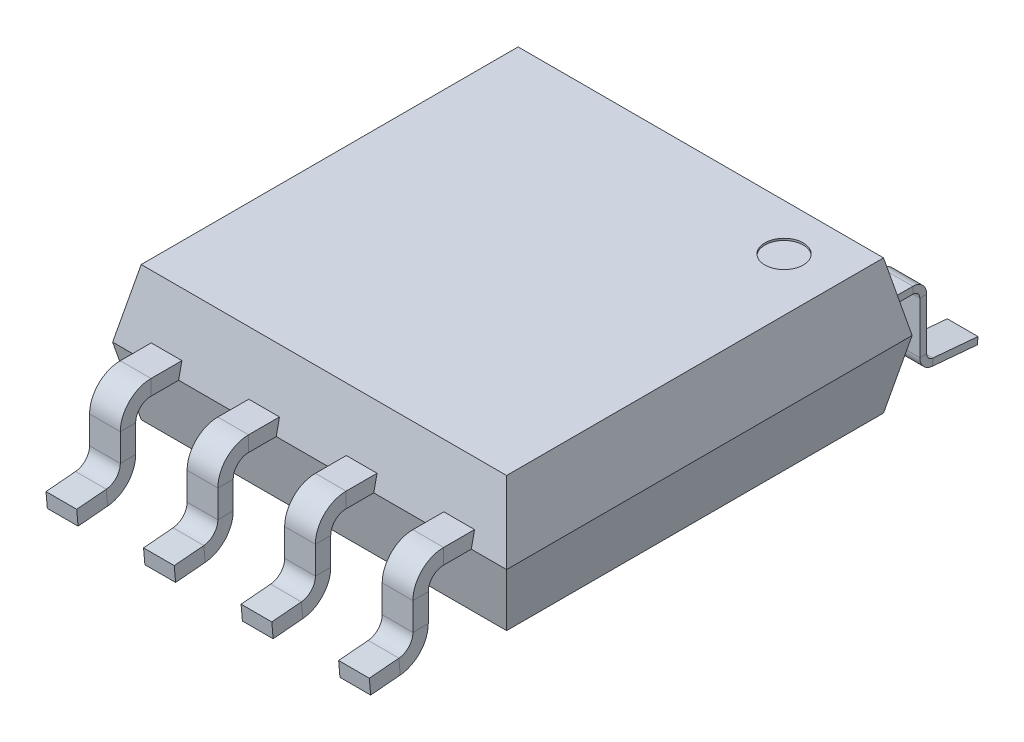
from build123d import *

# Parameters (mm, degrees)
SKETCH1_W                     = 5.13
SKETCH1_H                     = 5.28
BOSS_EXTRUDE1_DEPTH           = 0.875
BOSS_EXTRUDE1_TAPER           = 12
BOSS_EXTRUDE1_OTHER_WAY_DEPTH = 0.875
BOSS_EXTRUDE1_OTHER_WAY_TAPER = 12
BASE_FLANGE1_DEPTH            = 0.2
BASE_FLANGE1_DEPTH_BACK       = 0.2
LPATTERN1_COUNT               = 3
LPATTERN1_PITCH               = 1.27
LPATTERN1_2_COUNT             = 2
LPATTERN1_2_PITCH             = 1.27
BASE_FLANGE2_DEPTH            = 0.2
BASE_FLANGE2_DEPTH_BACK       = 0.2
LPATTERN2_COUNT               = 2
LPATTERN2_PITCH               = 1.27
LPATTERN2_2_COUNT             = 3
LPATTERN2_2_PITCH             = 1.27
SKETCH87_R                    = 0.25
CUT_EXTRUDE1_DEPTH            = 0.025


# Sheet-metal steps are written as plain solids
with BuildPart() as part:
    # Sketch1 → Boss-Extrude1 (new body)
    with BuildSketch(Plane(origin=(0, 0, 0), x_dir=(1, 0, 0), z_dir=(0, 1, 0))):
        Rectangle(SKETCH1_W, SKETCH1_H)
    extrude(amount=BOSS_EXTRUDE1_DEPTH, taper=BOSS_EXTRUDE1_TAPER)

    # Sketch1 → Boss-Extrude1 other way (add)
    with BuildSketch(Plane(origin=(0, 0, 0), x_dir=(1, 0, 0), z_dir=(0, 1, 0))):
        Rectangle(SKETCH1_W, SKETCH1_H)
    extrude(amount=-BOSS_EXTRUDE1_OTHER_WAY_DEPTH, taper=BOSS_EXTRUDE1_OTHER_WAY_TAPER)

    # Sketch87 → Cut-Extrude1 (cut)
    with BuildSketch(Plane(origin=(0, 0.875, 0), x_dir=(1, 0, 0), z_dir=(0, 1, 0))):
        with Locations(Location((1.686972144, 1.850895493, 0), (0, 0, 270))):
            Circle(SKETCH87_R)
    extrude(amount=-CUT_EXTRUDE1_DEPTH, mode=Mode.SUBTRACT)


with BuildPart() as body_2:
    # Sketch2 → Base-Flange1 (new, two sides: drawn at the far end of the back side and taken through both)
    with BuildSketch(Plane(origin=(-0.635, 0, 0), x_dir=(0, 0, -1), z_dir=(1, 0, 0)).offset(-BASE_FLANGE1_DEPTH_BACK)):
        with BuildLine():
            Line((-2.54, 0), (-2.64, 0))
            Line((-2.64, 0), (-3, 0))
            ThreePointArc((-3, 0), (-3.141421356, -0.058578644), (-3.2, -0.2))
            Line((-3.2, -0.2), (-3.2, -0.55846753))
            ThreePointArc((-3.2, -0.55846753), (-3.305089065, -0.828703613), (-3.565137703, -0.95694541))
            Line((-3.565137703, -0.95694541), (-3.95, -0.990616498))
            Line((-3.95, -0.990616498), (-3.967431149, -0.791377558))
            Line((-3.967431149, -0.791377558), (-3.582568851, -0.75770647))
            ThreePointArc((-3.582568851, -0.75770647), (-3.452544533, -0.693585572), (-3.4, -0.55846753))
            Line((-3.4, -0.55846753), (-3.4, -0.2))
            ThreePointArc((-3.4, -0.2), (-3.282842712, 0.082842712), (-3, 0.2))
            Line((-3, 0.2), (-2.64, 0.2))
            Line((-2.64, 0.2), (-2.54, 0.2))
            Line((-2.54, 0.2), (-2.54, 0))
        make_face()
    extrude(amount=BASE_FLANGE1_DEPTH + BASE_FLANGE1_DEPTH_BACK)


with BuildPart() as lpattern1_1:
    # LPattern1: pattern copy
    add(body_2.part.moved(Location(Vector(1, 0, 0) * (1 * LPATTERN1_PITCH))))


with BuildPart() as lpattern1_2:
    # LPattern1: pattern copy
    add(body_2.part.moved(Location(Vector(1, 0, 0) * (2 * LPATTERN1_PITCH))))


with BuildPart() as lpattern1_2_1:
    # LPattern1 2: pattern copy
    add(body_2.part.moved(Location(Vector(-1, 0, 0) * (1 * LPATTERN1_2_PITCH))))


with BuildPart() as body_6:
    # Sketch58 → Base-Flange2 (new, two sides: drawn at the far end of the back side and taken through both)
    with BuildSketch(Plane(origin=(-0.635, 0, 0), x_dir=(0, 0, -1), z_dir=(1, 0, 0)).offset(-BASE_FLANGE2_DEPTH_BACK)):
        with BuildLine():
            Line((2.54, 0), (2.64, 0))
            Line((2.64, 0), (3.11, 0))
            ThreePointArc((3.11, 0), (3.17363961, -0.02636039), (3.2, -0.09))
            Line((3.2, -0.09), (3.2, -0.760060389))
            ThreePointArc((3.2, -0.760060389), (3.247290079, -0.881666626), (3.364311966, -0.939375434))
            Line((3.364311966, -0.939375434), (3.95, -0.990616498))
            Line((3.95, -0.990616498), (3.957844017, -0.900958975))
            Line((3.957844017, -0.900958975), (3.372155983, -0.849717912))
            ThreePointArc((3.372155983, -0.849717912), (3.31364504, -0.820863507), (3.29, -0.760060389))
            Line((3.29, -0.760060389), (3.29, -0.09))
            ThreePointArc((3.29, -0.09), (3.237279221, 0.037279221), (3.11, 0.09))
            Line((3.11, 0.09), (2.64, 0.09))
            Line((2.64, 0.09), (2.54, 0.09))
            Line((2.54, 0.09), (2.54, 0))
        make_face()
    extrude(amount=BASE_FLANGE2_DEPTH + BASE_FLANGE2_DEPTH_BACK)


with BuildPart() as lpattern2_1:
    # LPattern2: pattern copy
    add(body_6.part.moved(Location(Vector(-1, 0, 0) * (1 * LPATTERN2_PITCH))))


with BuildPart() as lpattern2_2_1:
    # LPattern2 2: pattern copy
    add(body_6.part.moved(Location(Vector(1, 0, 0) * (1 * LPATTERN2_2_PITCH))))


with BuildPart() as lpattern2_2_2:
    # LPattern2 2: pattern copy
    add(body_6.part.moved(Location(Vector(1, 0, 0) * (2 * LPATTERN2_2_PITCH))))


solid = Compound([part.part, body_2.part, lpattern1_1.part, lpattern1_2.part, lpattern1_2_1.part, body_6.part, lpattern2_1.part, lpattern2_2_1.part, lpattern2_2_2.part])
